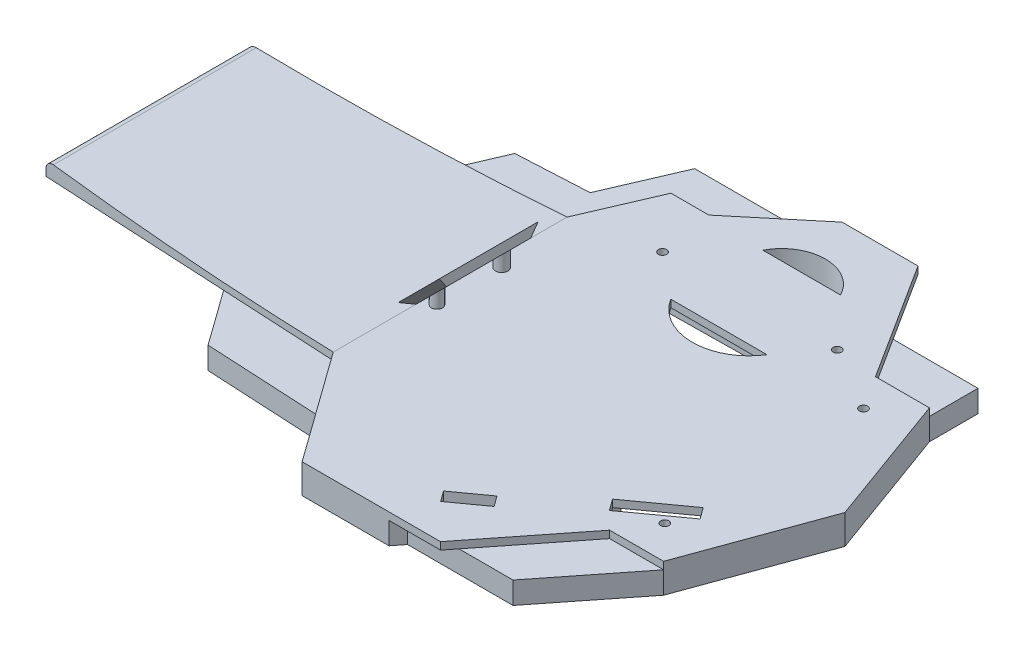
from build123d import *

# Parameters (mm, degrees)
EXTRUDE_1_DEPTH               = 2
EXTRUDE_2_DEPTH               = 2
CUT_EXTRUDE_3_DEPTH           = 202.869395429
CUT_EXTRUDE_3_DEPTH_BACK      = 202.869395429
FILLET_1_R                    = 2
EXTRUDE_4_DEPTH               = 6
CUT_EXTRUDE_7_DEPTH           = 202.98824919
EXTRUDE_5_DEPTH               = 2
EXTRUDE_5_DRAFT               = -45
EXTRUDE_11_REACH              = 204.137
SKETCH_24_R                   = 1.697293379
SKETCH_24_R_2                 = 1.5
CUT_EXTRUDE_8_DEPTH           = 203.13682253
SKETCH_26_W                   = 1.1303
SKETCH_26_H                   = 10
HOLE_WIZARD_4_40_3_AT_2_COUNT = 2
HOLE_WIZARD_4_40_3_AT_2_PITCH = 54.095245987
SKETCH_29_R                   = 3
EXTRUDE_14_DEPTH              = 5
SKETCH_32_W                   = 1.1303
SKETCH_32_H                   = 8
HOLE_WIZARD_4_40_4_AT_2_COUNT = 2
HOLE_WIZARD_4_40_4_AT_2_PITCH = 46.853089657
SKETCH_35_W                   = 1.1303
SKETCH_35_H                   = 6
HOLE_WIZARD_4_40_5_AT_2_COUNT = 2
HOLE_WIZARD_4_40_5_AT_2_PITCH = 67.324981434


with BuildPart() as part:
    # 草图2 → 凸台-拉伸1 (new body)
    with BuildSketch(Plane(origin=(0, 0, 0), x_dir=(1, 0, 0), z_dir=(0, 1, 0))):
        Polygon((141.821582241, 68.082690978), (121.161879345, 68.082690978), (101.35099463, 51.608897425), (91.039832206, 51.608897425), (82.527346571, 31.825074964), (0, 27.5), (0, -27.5), (82.527346571, -31.825074964), (104.14664553, -61.917309022), (141.821582241, -61.917309022), (162.133732132, -36.18552755), (176.829545061, -36.18552755), (190, 0), (176.829545061, 36.18552755), (162.133732132, 36.18552755), align=None)
    extrude(amount=EXTRUDE_1_DEPTH)

    # 草图6 → 凸台-拉伸2 (add)
    with BuildSketch(Plane(origin=(0, 2, 0), x_dir=(1, 0, 0), z_dir=(0, 1, 0))):
        Polygon((82.527346571, 31.825074964), (82.527346571, -31.825074964), (0, -27.5), (0, 27.5), align=None)
    extrude(amount=EXTRUDE_2_DEPTH)

    # 草图7 → 切除-拉伸3 (cut, two sides: drawn at the far end of the back side and taken through both)
    with BuildSketch(Plane.XY.offset(-CUT_EXTRUDE_3_DEPTH_BACK)):
        with BuildLine():
            Line((82.527346571, 2), (82.527346571, 30.740821148))
            Line((82.527346571, 30.740821148), (0, 4))
            add(Edge.make_bspline(
                [(82.527346571, 2), (41.215261335, 1.001172546), (0, 4)],
                knots=[0, 0, 0, 1, 1, 1], degree=2))
        make_face()
    extrude(amount=CUT_EXTRUDE_3_DEPTH + CUT_EXTRUDE_3_DEPTH_BACK, mode=Mode.SUBTRACT)

    # 圆角1
    fillet_1_edges = [part.edges().sort_by_distance(p)[0] for p in [
        (0, 4, 13.75),
    ]]
    fillet(fillet_1_edges, radius=FILLET_1_R)

    # 草图13 → 凸台-拉伸4 (add)
    with BuildSketch(Plane.XZ):
        Polygon((53.501507434, -30.303895193), (58.412275987, -41.716986195), (77.926898746, -42.739704237), (86.484415452, -62.62818317), (136.164724768, -62.62818317), (144.584081331, -49.40685536), (176.829545061, -49.40685536), (176.829545061, -36.18552755), (190, 0), (176.829545061, 36.18552755), (158.743204348, 59.097615602), (130.016377906, 59.097615602), (127.790568727, 61.917309022), (104.14664553, 61.917309022), (93.336996051, 46.871191993), (61.845926158, 45.220814953), (51.036276678, 30.174697924), (171.852914921, 31.825074964), (171.852914921, -31.825074964), align=None)
    extrude(amount=EXTRUDE_4_DEPTH)

    # 草图18 → 切除-拉伸7 (cut, through all)
    with BuildSketch(Plane(origin=(0, 2, 0), x_dir=(1, 0, 0), z_dir=(0, 1, 0))):
        Polygon((169.563862496, -18.125868021), (155.218286362, -28.471875769), (157.463858458, -31.585543016), (171.809434591, -21.239535267), align=None)
        Polygon((130.302091903, -49.564637909), (132.361562224, -52.420260001), (140.814695434, -46.323873151), (138.755225113, -43.468251059), align=None)
    extrude(amount=-CUT_EXTRUDE_7_DEPTH, mode=Mode.SUBTRACT)

    # 草图17 → 切除-拉伸8 (cut, through all)
    with BuildSketch(Plane(origin=(0, 2, 0), x_dir=(1, 0, 0), z_dir=(0, 1, 0))):
        with BuildLine():
            Line((142.181150975, 26.59529287), (116.011181983, 26.59529287))
            ThreePointArc((116.011181983, 26.59529287), (129.096166479, 19.355270398), (142.181150975, 26.59529287))
        make_face()
        with BuildLine():
            Line((116.98958299, 50.681307574), (138.127410429, 50.681307574))
            ThreePointArc((138.127410429, 50.681307574), (127.55849671, 57.129732827), (116.98958299, 50.681307574))
        make_face()
    extrude(amount=-CUT_EXTRUDE_8_DEPTH, mode=Mode.SUBTRACT)

    # 草图26 → #4-40 螺纹孔3 (revolve, cut)
    with BuildSketch(Plane(origin=(168.015540482, 4, 27.047622993), x_dir=(0, 0, 1), z_dir=(1, 0, 0))):
        with Locations((0.56515, 5)):
            Rectangle(SKETCH_26_W, SKETCH_26_H)
    hole_wizard_4_40_3 = revolve(axis=Axis((168.015540482, 10.35, 27.047622993), (0, -1, 0)), mode=Mode.SUBTRACT)

    # #4-40 螺纹孔3 at 2: #4-40 螺纹孔3 ×2
    with Locations(*[(0, 0, -i * HOLE_WIZARD_4_40_3_AT_2_PITCH) for i in range(1, HOLE_WIZARD_4_40_3_AT_2_COUNT)]):
        add(hole_wizard_4_40_3, mode=Mode.SUBTRACT)

    # 草图29 → 凸台-拉伸14 (add)
    with BuildSketch(Plane.XZ):
        with Locations((67.061317629, 25.566411224)):
            Circle(SKETCH_29_R)
        with Locations((67.061317629, -25.566411224)):
            Circle(SKETCH_29_R)
        with Locations((150.788762168, 25.939901438)):
            Circle(SKETCH_29_R)
        with Locations((150.788762168, -25.939901438)):
            Circle(SKETCH_29_R)
    extrude(amount=EXTRUDE_14_DEPTH)

    # 草图32 → #4-40 螺纹孔4 (revolve, cut)
    with BuildSketch(Plane(origin=(150.596828184, 2, -37.334382376), x_dir=(0, 0, 1), z_dir=(1, 0, 0))):
        with Locations((0.56515, 4)):
            Rectangle(SKETCH_32_W, SKETCH_32_H)
    hole_wizard_4_40_4 = revolve(axis=Axis((150.596828184, 8.35, -37.334382376), (0, -1, 0)), mode=Mode.SUBTRACT)

    # #4-40 螺纹孔4 at 2: #4-40 螺纹孔4 ×2
    with Locations(*[Vector(-0.9998798859192506, 0, 0.015498830088316725) * (i * HOLE_WIZARD_4_40_4_AT_2_PITCH) for i in range(1, HOLE_WIZARD_4_40_4_AT_2_COUNT)]):
        add(hole_wizard_4_40_4, mode=Mode.SUBTRACT)

    # 草图35 → #4-40 螺纹孔5 (revolve, cut)
    with BuildSketch(Plane(origin=(176.735584933, 0, 15.639737001), x_dir=(0, 0, 1), z_dir=(1, 0, 0))):
        with Locations((0.56515, 3)):
            Rectangle(SKETCH_35_W, SKETCH_35_H)
    hole_wizard_4_40_5 = revolve(axis=Axis((176.735584933, 6.35, 15.639737001), (0, -1, 0)), mode=Mode.SUBTRACT)

    # #4-40 螺纹孔5 at 2: #4-40 螺纹孔5 ×2
    with Locations(*[Vector(-0.8103060721730659, 0, 0.5860068851126735) * (i * HOLE_WIZARD_4_40_5_AT_2_PITCH) for i in range(1, HOLE_WIZARD_4_40_5_AT_2_COUNT)]):
        add(hole_wizard_4_40_5, mode=Mode.SUBTRACT)


with BuildPart() as body_2:
    # 草图23 → 凸台-拉伸5 (with draft: the straight prism first)
    with BuildSketch(Plane(origin=(40.263673286, -40.263673286, 0), x_dir=(0, 0, -1), z_dir=(-0.7071067811865488, 0.7071067811865464, 0))):
        Polygon((-9.292036768, -59.769859956), (-9.292036768, -60.809778756), (-9.292036768, -71.520555916), (13.638077716, -71.520555916), (13.638077716, -59.769859956), align=None)
    extrude(amount=EXTRUDE_5_DEPTH)
    # 凸台-拉伸5: the draft: its side faces are tilted about the plane it starts from
    extrude_5_sides = [body_2.faces().sort_by_distance(p)[0] for p in [
        (85.974738189, 6.86160518, 9.292036768),
        (85.974738189, 6.86160518, -13.638077716),
        (90.129236587, 11.016103578, -2.173020474),
        (81.82023979, 2.707106781, -2.173020474),
    ]]
    draft(extrude_5_sides, Plane(origin=(40.263673286, -40.263673286, 0), x_dir=(0, 0, -1), z_dir=(-0.7071067811865488, 0.7071067811865464, 0)), EXTRUDE_5_DRAFT)


with BuildPart() as body_3:
    # 凸台-拉伸11: up to this plane
    extrude_11_end = Plane(origin=(40.263673286, -40.263673286, 0), z_dir=(0.7071067811865476, -0.7071067811865476, 0))
    # 草图24 → 凸台-拉伸11 (new, up to the surface)
    with BuildSketch(Plane(origin=(0, 2, 0), x_dir=(1, 0, 0), z_dir=(0, 1, 0)), mode=Mode.PRIVATE) as extrude_11_sk1:
        with Locations((85.490261725, 11.047785882)):
            Circle(SKETCH_24_R)
    extrude_11_tool1 = split(extrude(extrude_11_sk1.sketch, amount=EXTRUDE_11_REACH, mode=Mode.PRIVATE), bisect_by=extrude_11_end, keep=Keep.BOTH, mode=Mode.PRIVATE)
    add(extrude_11_tool1.solids().sort_by_distance((85.490262, 2, -11.047786))[0])
    # 草图24 → 凸台-拉伸11 (new, up to the surface)
    with BuildSketch(Plane(origin=(0, 2, 0), x_dir=(1, 0, 0), z_dir=(0, 1, 0)), mode=Mode.PRIVATE) as extrude_11_sk2:
        with Locations((85.490261725, -6.54134788)):
            Circle(SKETCH_24_R_2)
    extrude_11_tool2 = split(extrude(extrude_11_sk2.sketch, amount=EXTRUDE_11_REACH, mode=Mode.PRIVATE), bisect_by=extrude_11_end, keep=Keep.BOTH, mode=Mode.PRIVATE)
    add(extrude_11_tool2.solids().sort_by_distance((85.490262, 2, 6.541348))[0])


solid = Compound([part.part, body_2.part, body_3.part])
